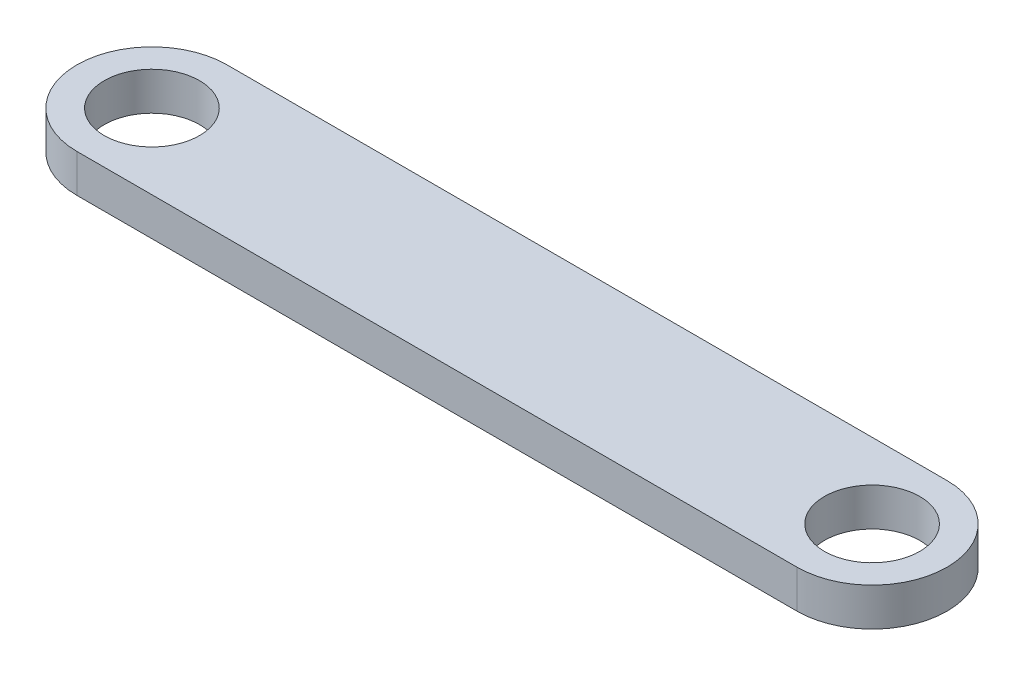
from build123d import *

# Parameters (mm, degrees)
SKETCH1_R           = 3.96875
BOSS_EXTRUDE1_DEPTH = 3.175


with BuildPart() as part:
    # Sketch1 → Boss-Extrude1 (new body)
    with BuildSketch(Plane(origin=(0, 0, 0), x_dir=(1, 0, 0), z_dir=(0, 1, 0))):
        with BuildLine():
            Line((-30, 6.25), (30, 6.25))
            ThreePointArc((30, 6.25), (36.25, 0), (30, -6.25))
            Line((30, -6.25), (-30, -6.25))
            ThreePointArc((-30, -6.25), (-36.25, 0), (-30, 6.25))
        make_face()
        with Locations((-30, 0)):
            Circle(SKETCH1_R, mode=Mode.SUBTRACT)
        with Locations((30, 0)):
            Circle(SKETCH1_R, mode=Mode.SUBTRACT)
    extrude(amount=BOSS_EXTRUDE1_DEPTH)


solid = part.part
